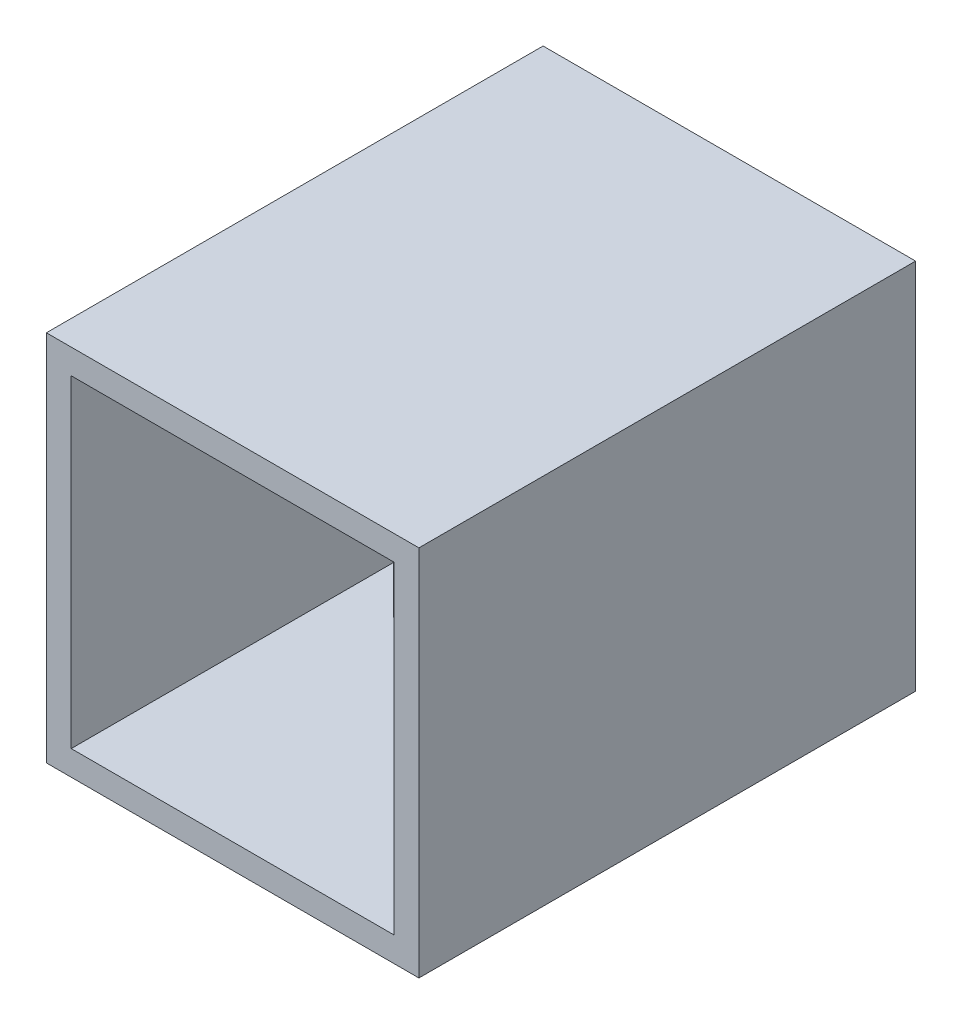
from build123d import *

# Parameters (mm, degrees)
SKETCH1_W           = 1500
SKETCH1_H           = 1500
SKETCH1_W_2         = 1300
SKETCH1_H_2         = 1300
BOSS_EXTRUDE1_DEPTH = 2000
SKETCH2_R           = 250
BOSS_EXTRUDE2_DEPTH = 1000


with BuildPart() as part:
    # Sketch1 → Boss-Extrude1 (new body)
    with BuildSketch(Plane.XY):
        with Locations((750, 750)):
            Rectangle(SKETCH1_W, SKETCH1_H)
        with Locations((750, 750)):
            Rectangle(SKETCH1_W_2, SKETCH1_H_2, mode=Mode.SUBTRACT)
    extrude(amount=BOSS_EXTRUDE1_DEPTH)

    # Sketch2 → Boss-Extrude2 (add)
    with BuildSketch(Plane.XZ.offset(-1400)):
        with Locations((750, 1000)):
            Circle(SKETCH2_R)
    extrude(amount=BOSS_EXTRUDE2_DEPTH)


solid = part.part
